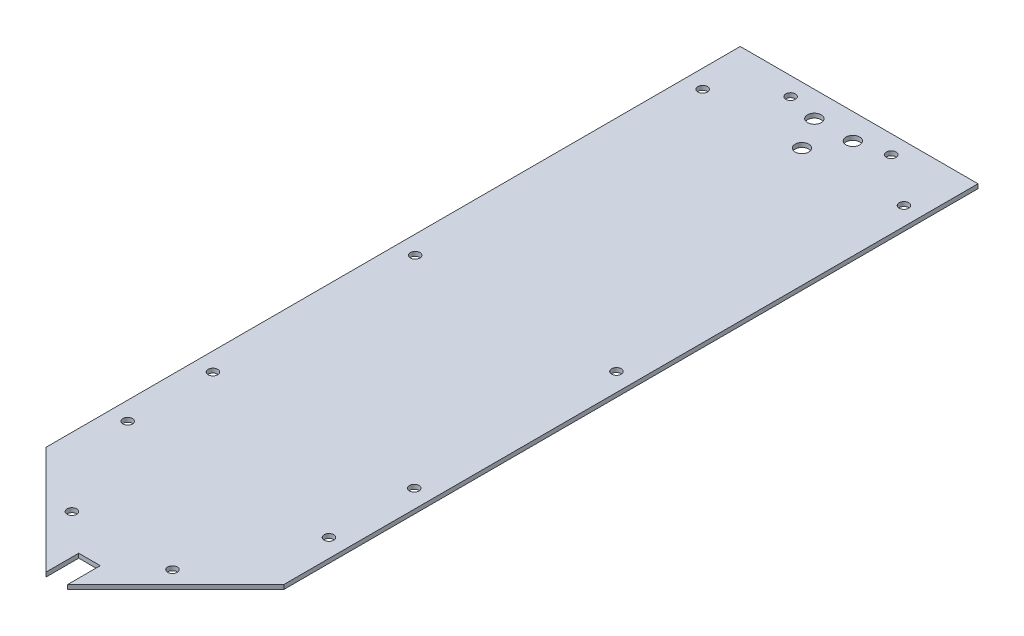
from build123d import *

# Parameters (mm, degrees)
BOSS_EXTRUDE1_DEPTH     = 3
CUT_EXTRUDE2_DEPTH      = 572.681821565
CUT_EXTRUDE2_DEPTH_BACK = 572.681821565
SKETCH8_R               = 3.325
CUT_EXTRUDE3_DEPTH      = 572.681821565
CUT_EXTRUDE3_DEPTH_BACK = 572.681821565
SKETCH9_R               = 4.75


with BuildPart() as part:
    # Sketch1 → Boss-Extrude1 (new body)
    with BuildSketch(Plane(origin=(0, 0, 0), x_dir=(1, 0, 0), z_dir=(0, 1, 0))):
        Polygon((7.5, 7.5), (82.7, 82.7), (82.7, 565.66051224), (-82.7, 565.66051224), (-82.7, 82.7), (-7.5, 7.5), (-7.5, 30.27243444), (7.5, 30.27243444), align=None)
    extrude(amount=-BOSS_EXTRUDE1_DEPTH)

    # Sketch8 → Cut-Extrude2 (cut, two sides: drawn at the far end of the back side and taken through both)
    with BuildSketch(Plane(origin=(0, 0, 0), x_dir=(1, 0, 0), z_dir=(0, 1, 0)).offset(-CUT_EXTRUDE2_DEPTH_BACK)):
        with Locations((-69.969823611, 326.81051224)):
            Circle(SKETCH8_R)
        with Locations((70.030176389, 326.81051224)):
            Circle(SKETCH8_R)
        with Locations((-69.969823611, 126.81051224)):
            Circle(SKETCH8_R)
        with Locations((-69.969823611, 526.81051224)):
            Circle(SKETCH8_R)
        with Locations((70.030176389, 126.81051224)):
            Circle(SKETCH8_R)
        with Locations((70.030176389, 526.81051224)):
            Circle(SKETCH8_R)
        with Locations((-34.969823611, 52.96051224)):
            Circle(SKETCH8_R)
        with Locations((35.030176389, 52.96051224)):
            Circle(SKETCH8_R)
        with Locations((35.030176389, 552.96051224)):
            Circle(SKETCH8_R)
        with Locations((-34.969823611, 552.96051224)):
            Circle(SKETCH8_R)
        with Locations((-69.969823611, 186.12171224)):
            Circle(SKETCH8_R)
        with Locations((70.030176389, 186.12171224)):
            Circle(SKETCH8_R)
    extrude(amount=CUT_EXTRUDE2_DEPTH + CUT_EXTRUDE2_DEPTH_BACK, mode=Mode.SUBTRACT)

    # Sketch9 → Cut-Extrude3 (cut, two sides: drawn at the far end of the back side and taken through both)
    with BuildSketch(Plane(origin=(0, 0, 0), x_dir=(1, 0, 0), z_dir=(0, 1, 0)).offset(-CUT_EXTRUDE3_DEPTH_BACK)):
        with Locations((0, 525.91051224)):
            Circle(SKETCH9_R)
        with Locations((13.4, 547.91051224)):
            Circle(SKETCH9_R)
        with Locations((-13.4, 547.91051224)):
            Circle(SKETCH9_R)
    extrude(amount=CUT_EXTRUDE3_DEPTH + CUT_EXTRUDE3_DEPTH_BACK, mode=Mode.SUBTRACT)


solid = part.part
